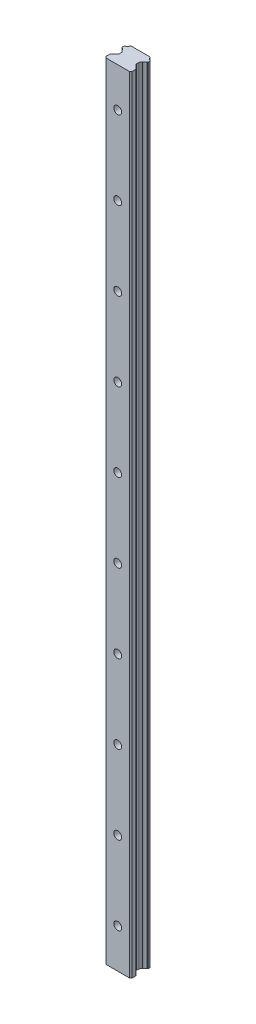
from build123d import *

# Parameters (mm, degrees)
EXTRUDE_1_DEPTH               = 600
SKETCH_80_R                   = 4.75
EXTRUDE_12_DEPTH              = 0.9
PATTERN_START                 = -17.499999985
PATTERN_LINEAR_1_OUTLINE_R    = 4.75
PATTERN_LINEAR_1_DEPTH        = 0.9
PATTERN_LINEAR_1_2_OUTLINE_R  = 4.75
PATTERN_LINEAR_1_2_DEPTH      = 0.9
PATTERN_LINEAR_1_3_OUTLINE_R  = 4.75
PATTERN_LINEAR_1_3_DEPTH      = 0.9
PATTERN_LINEAR_1_4_OUTLINE_R  = 4.75
PATTERN_LINEAR_1_4_DEPTH      = 0.9
PATTERN_LINEAR_1_5_OUTLINE_R  = 4.75
PATTERN_LINEAR_1_5_DEPTH      = 0.9
PATTERN_LINEAR_1_6_OUTLINE_R  = 4.75
PATTERN_LINEAR_1_6_DEPTH      = 0.9
PATTERN_LINEAR_1_7_OUTLINE_R  = 4.75
PATTERN_LINEAR_1_7_DEPTH      = 0.9
PATTERN_LINEAR_1_8_OUTLINE_R  = 4.75
PATTERN_LINEAR_1_8_DEPTH      = 0.9
PATTERN_LINEAR_1_9_OUTLINE_R  = 4.75
PATTERN_LINEAR_1_9_DEPTH      = 0.9
PATTERN_LINEAR_1_10_OUTLINE_R = 4.75
PATTERN_LINEAR_1_10_DEPTH     = 8.499999985
PATTERN_START_2               = -9
PATTERN_LINEAR_1_11_OUTLINE_R = 3
PATTERN_LINEAR_1_11_DEPTH     = 9


# Read off the part's stored shape, not the designer's step: Линейный массив1
with BuildPart() as part:
    # Эскиз1 → Бобышка-Вытянуть1 (new body)
    with BuildSketch(Plane(origin=(0, 0, 0), x_dir=(1, 0, 0), z_dir=(0, 1, 0))):
        with BuildLine():
            Line((-10, 3.656507036), (-10, 1))
            Line((-10, 1), (-9, 0))
            Line((-9, 0), (9, 0))
            Line((9, 0), (10, 1))
            Line((10, 1), (10, 3.656507036))
            ThreePointArc((10, 3.656507036), (9.92387953, 4.039190479), (9.707106773, 4.363613837))
            Line((9.707106773, 4.363613837), (6.892893227, 7.177827383))
            ThreePointArc((6.892893227, 7.177827383), (6.67612047, 7.502250741), (6.6, 7.884934184))
            Line((6.6, 7.884934184), (6.6, 9.445065806))
            ThreePointArc((6.6, 9.445065806), (6.67612047, 9.827749249), (6.892893227, 10.152172607))
            Line((6.892893227, 10.152172607), (7.63016236, 10.88944174))
            ThreePointArc((7.63016236, 10.88944174), (7.773916172, 11.035785914), (7.84680643, 11.2275378))
            ThreePointArc((7.84680643, 11.2275378), (8.39638832, 12.26292769), (9.431778202, 12.812509595))
            ThreePointArc((9.431778202, 12.812509595), (9.571493891, 12.861817755), (9.690625709, 12.949905089))
            Line((9.690625709, 12.949905089), (9.85355341, 13.11283279))
            ThreePointArc((9.85355341, 13.11283279), (9.961939771, 13.275044443), (10, 13.466386134))
            Line((10, 13.466386134), (10, 14.523613836))
            ThreePointArc((10, 14.523613836), (9.961939771, 14.714955527), (9.85355341, 14.87716718))
            Line((9.85355341, 14.87716718), (9.678500897, 15.052219693))
            ThreePointArc((9.678500897, 15.052219693), (9.560417661, 15.139748844), (9.421985093, 15.189159641))
            ThreePointArc((9.421985093, 15.189159641), (8.395921978, 15.736919382), (7.84816224, 16.7629825))
            ThreePointArc((7.84816224, 16.7629825), (7.775191486, 16.953000828), (7.632531165, 17.098189425))
            Line((7.632531165, 17.098189425), (7.230720605, 17.499999985))
            Line((7.230720605, 17.499999985), (-7.230720615, 17.499999985))
            Line((-7.230720615, 17.499999985), (-7.632531175, 17.098189425))
            ThreePointArc((-7.632531175, 17.098189425), (-7.775191503, 16.953000832), (-7.84816225, 16.7629825))
            ThreePointArc((-7.84816225, 16.7629825), (-8.395921997, 15.736919373), (-9.421985128, 15.189159636))
            ThreePointArc((-9.421985128, 15.189159636), (-9.560417671, 15.13974885), (-9.678500884, 15.052219716))
            Line((-9.678500884, 15.052219716), (-9.85355341, 14.87716719))
            ThreePointArc((-9.85355341, 14.87716719), (-9.961939771, 14.714955537), (-10, 14.523613846))
            Line((-10, 14.523613846), (-10, 13.466386134))
            ThreePointArc((-10, 13.466386134), (-9.961939771, 13.275044443), (-9.85355341, 13.11283279))
            Line((-9.85355341, 13.11283279), (-9.690625667, 12.949905047))
            ThreePointArc((-9.690625667, 12.949905047), (-9.57149389, 12.861817745), (-9.431778248, 12.812509604))
            ThreePointArc((-9.431778248, 12.812509604), (-8.396388337, 12.262927707), (-7.84680643, 11.2275378))
            ThreePointArc((-7.84680643, 11.2275378), (-7.773916168, 11.035785916), (-7.63016236, 10.88944174))
            Line((-7.63016236, 10.88944174), (-6.892893227, 10.152172607))
            ThreePointArc((-6.892893227, 10.152172607), (-6.67612047, 9.827749249), (-6.6, 9.445065806))
            Line((-6.6, 9.445065806), (-6.6, 7.884934184))
            ThreePointArc((-6.6, 7.884934184), (-6.67612047, 7.502250741), (-6.892893227, 7.177827383))
            Line((-6.892893227, 7.177827383), (-9.707106773, 4.363613837))
            ThreePointArc((-9.707106773, 4.363613837), (-9.92387953, 4.039190479), (-10, 3.656507036))
        make_face()
    extrude(amount=-EXTRUDE_1_DEPTH)

    # Эскиз6 → Вырез-Повернуть1 (revolve, cut)
    with BuildSketch(Plane(origin=(0, 30, 0), x_dir=(0, -1, 0), z_dir=(1, 0, 0)), mode=Mode.PRIVATE) as cut_revolve_1_sk:
        Polygon((55.25, 17.499999985), (60, 17.499999985), (60, 0), (57, 0), (57, 9), (55.25, 9), align=None)
    revolve(cut_revolve_1_sk.sketch.rotate(Axis((0, -30, -17.499999985), (0, 0, 1)), 270), axis=Axis((0, -30, -17.499999985), (0, 0, 1)), mode=Mode.SUBTRACT)

    # Pattern Linear 1 10 outline → Pattern Linear 1 10 (cut)
    with BuildSketch(Plane.XY.offset(PATTERN_START)):
        with Locations((0, -90)):
            Circle(PATTERN_LINEAR_1_10_OUTLINE_R)
        with Locations((0, -150)):
            Circle(PATTERN_LINEAR_1_10_OUTLINE_R)
        with Locations((0, -210)):
            Circle(PATTERN_LINEAR_1_10_OUTLINE_R)
        with Locations((0, -270)):
            Circle(PATTERN_LINEAR_1_10_OUTLINE_R)
        with Locations((0, -330)):
            Circle(PATTERN_LINEAR_1_10_OUTLINE_R)
        with Locations((0, -390)):
            Circle(PATTERN_LINEAR_1_10_OUTLINE_R)
        with Locations((0, -450)):
            Circle(PATTERN_LINEAR_1_10_OUTLINE_R)
        with Locations((0, -510)):
            Circle(PATTERN_LINEAR_1_10_OUTLINE_R)
        with Locations((0, -570)):
            Circle(PATTERN_LINEAR_1_10_OUTLINE_R)
    extrude(amount=PATTERN_LINEAR_1_10_DEPTH, mode=Mode.SUBTRACT)

    # Pattern Linear 1 11 outline → Pattern Linear 1 11 (cut)
    with BuildSketch(Plane.XY.offset(PATTERN_START_2)):
        with Locations((0, -90)):
            Circle(PATTERN_LINEAR_1_11_OUTLINE_R)
        with Locations((0, -150)):
            Circle(PATTERN_LINEAR_1_11_OUTLINE_R)
        with Locations((0, -210)):
            Circle(PATTERN_LINEAR_1_11_OUTLINE_R)
        with Locations((0, -270)):
            Circle(PATTERN_LINEAR_1_11_OUTLINE_R)
        with Locations((0, -330)):
            Circle(PATTERN_LINEAR_1_11_OUTLINE_R)
        with Locations((0, -390)):
            Circle(PATTERN_LINEAR_1_11_OUTLINE_R)
        with Locations((0, -450)):
            Circle(PATTERN_LINEAR_1_11_OUTLINE_R)
        with Locations((0, -510)):
            Circle(PATTERN_LINEAR_1_11_OUTLINE_R)
        with Locations((0, -570)):
            Circle(PATTERN_LINEAR_1_11_OUTLINE_R)
    extrude(amount=PATTERN_LINEAR_1_11_DEPTH, mode=Mode.SUBTRACT)


with BuildPart() as body_2:
    # Эскиз80 → Бобышка-Вытянуть12 (new body)
    with BuildSketch(Plane(origin=(0, 0, -17.499999985), x_dir=(-1, 0, 0), z_dir=(0, 0, -1))):
        with Locations((0, -30)):
            Circle(SKETCH_80_R)
    extrude(amount=-EXTRUDE_12_DEPTH)


with BuildPart() as body_3:
    # Линейный массив1 outline → Линейный массив1 (new body)
    with BuildSketch(Plane.XY.offset(PATTERN_START)):
        with Locations((0, -570)):
            Circle(PATTERN_LINEAR_1_OUTLINE_R)
    extrude(amount=PATTERN_LINEAR_1_DEPTH)


with BuildPart() as body_4:
    # Pattern Linear 1 2 outline → Pattern Linear 1 2 (new body)
    with BuildSketch(Plane.XY.offset(PATTERN_START)):
        with Locations((0, -510)):
            Circle(PATTERN_LINEAR_1_2_OUTLINE_R)
    extrude(amount=PATTERN_LINEAR_1_2_DEPTH)


with BuildPart() as body_5:
    # Pattern Linear 1 3 outline → Pattern Linear 1 3 (new body)
    with BuildSketch(Plane.XY.offset(PATTERN_START)):
        with Locations((0, -450)):
            Circle(PATTERN_LINEAR_1_3_OUTLINE_R)
    extrude(amount=PATTERN_LINEAR_1_3_DEPTH)


with BuildPart() as body_6:
    # Pattern Linear 1 4 outline → Pattern Linear 1 4 (new body)
    with BuildSketch(Plane.XY.offset(PATTERN_START)):
        with Locations((0, -390)):
            Circle(PATTERN_LINEAR_1_4_OUTLINE_R)
    extrude(amount=PATTERN_LINEAR_1_4_DEPTH)


with BuildPart() as body_7:
    # Pattern Linear 1 5 outline → Pattern Linear 1 5 (new body)
    with BuildSketch(Plane.XY.offset(PATTERN_START)):
        with Locations((0, -330)):
            Circle(PATTERN_LINEAR_1_5_OUTLINE_R)
    extrude(amount=PATTERN_LINEAR_1_5_DEPTH)


with BuildPart() as body_8:
    # Pattern Linear 1 6 outline → Pattern Linear 1 6 (new body)
    with BuildSketch(Plane.XY.offset(PATTERN_START)):
        with Locations((0, -270)):
            Circle(PATTERN_LINEAR_1_6_OUTLINE_R)
    extrude(amount=PATTERN_LINEAR_1_6_DEPTH)


with BuildPart() as body_9:
    # Pattern Linear 1 7 outline → Pattern Linear 1 7 (new body)
    with BuildSketch(Plane.XY.offset(PATTERN_START)):
        with Locations((0, -210)):
            Circle(PATTERN_LINEAR_1_7_OUTLINE_R)
    extrude(amount=PATTERN_LINEAR_1_7_DEPTH)


with BuildPart() as body_10:
    # Pattern Linear 1 8 outline → Pattern Linear 1 8 (new body)
    with BuildSketch(Plane.XY.offset(PATTERN_START)):
        with Locations((0, -150)):
            Circle(PATTERN_LINEAR_1_8_OUTLINE_R)
    extrude(amount=PATTERN_LINEAR_1_8_DEPTH)


with BuildPart() as body_11:
    # Pattern Linear 1 9 outline → Pattern Linear 1 9 (new body)
    with BuildSketch(Plane.XY.offset(PATTERN_START)):
        with Locations((0, -90)):
            Circle(PATTERN_LINEAR_1_9_OUTLINE_R)
    extrude(amount=PATTERN_LINEAR_1_9_DEPTH)


solid = Compound([part.part, body_2.part, body_3.part, body_4.part, body_5.part, body_6.part, body_7.part, body_8.part, body_9.part, body_10.part, body_11.part])
